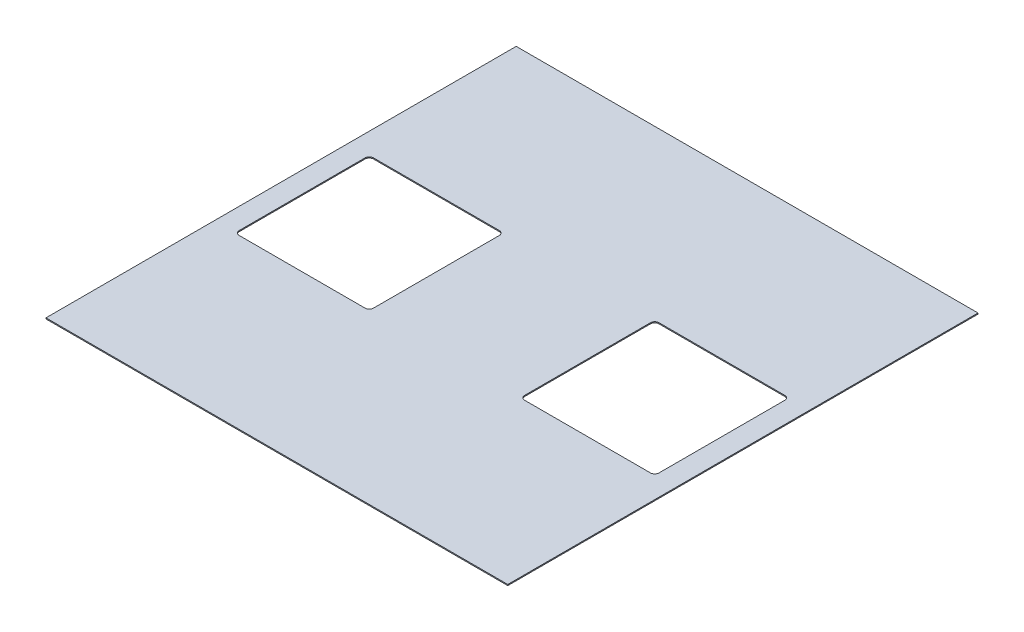
from build123d import *

# Parameters (mm, degrees)
SKETCH1_W           = 698.5
SKETCH1_H           = 711.2
SKETCH1_W_2         = 203.2
SKETCH1_H_2         = 203.2
BOSS_EXTRUDE1_DEPTH = 1.5875
FILLET1_R           = 6.35


with BuildPart() as part:
    # Sketch1 → Boss-Extrude1 (new body)
    with BuildSketch(Plane(origin=(0, 0, 0), x_dir=(1, 0, 0), z_dir=(0, 1, 0))):
        with Locations((349.25, -355.6)):
            Rectangle(SKETCH1_W, SKETCH1_H)
        with Locations((133.35, -355.6)):
            Rectangle(SKETCH1_W_2, SKETCH1_H_2, mode=Mode.SUBTRACT)
        with Locations((565.15, -355.6)):
            Rectangle(SKETCH1_W_2, SKETCH1_H_2, mode=Mode.SUBTRACT)
    extrude(amount=BOSS_EXTRUDE1_DEPTH)

    # Fillet1
    fillet1_edges = [part.edges().sort_by_distance(p)[0] for p in [
        (666.75, 0.79375, 457.2),
        (666.75, 0.79375, 254),
        (463.55, 0.79375, 254),
        (463.55, 0.79375, 457.2),
        (234.95, 0.79375, 457.2),
        (31.75, 0.79375, 457.2),
        (234.95, 0.79375, 254),
        (31.75, 0.79375, 254),
    ]]
    fillet(fillet1_edges, radius=FILLET1_R)


solid = part.part
